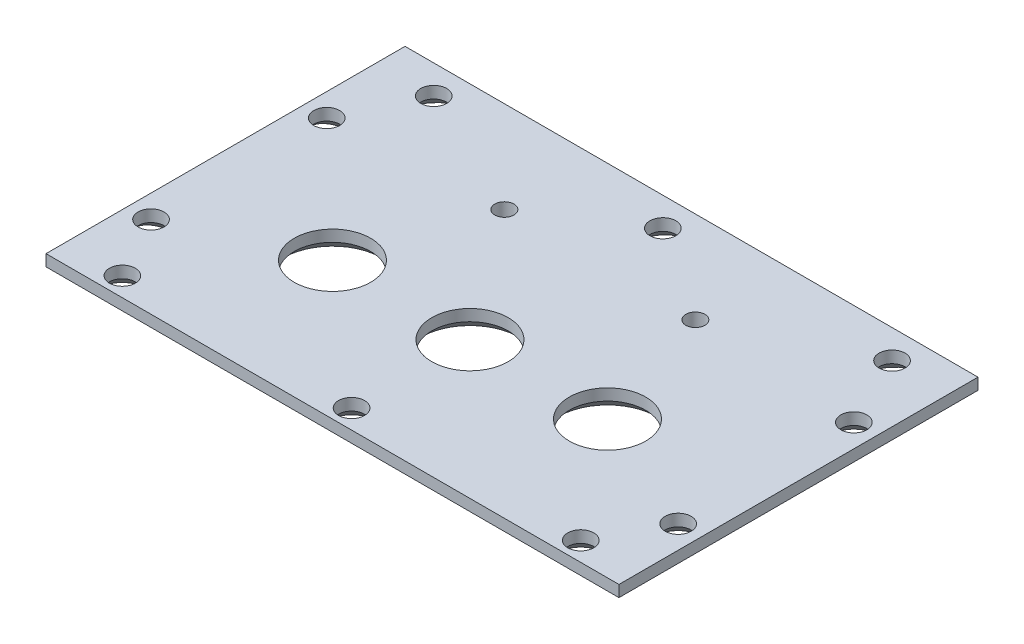
from build123d import *

# Parameters (mm, degrees)
SKETCH_1_W                 = 75
SKETCH_1_H                 = 47
SKETCH_1_R                 = 5
EXTRUDE_731_DEPTH          = 3
HOLE_WIZARD_M3_AT_2_COUNT  = 2
HOLE_WIZARD_M3_AT_2_PITCH  = 30
HOLE_WIZARD_M3_AT_3_COUNT  = 2
HOLE_WIZARD_M3_AT_3_PITCH  = 30
HOLE_WIZARD_M3_AT_4_COUNT  = 2
HOLE_WIZARD_M3_AT_4_PITCH  = 40.75
HOLE_WIZARD_M3_AT_5_COUNT  = 2
HOLE_WIZARD_M3_AT_5_PITCH  = 50.602000949
HOLE_WIZARD_M3_AT_6_COUNT  = 2
HOLE_WIZARD_M3_AT_6_PITCH  = 50.602000949
HOLE_WIZARD_M3_AT_7_COUNT  = 2
HOLE_WIZARD_M3_AT_7_PITCH  = 35.472700771
HOLE_WIZARD_M3_AT_8_COUNT  = 2
HOLE_WIZARD_M3_AT_8_PITCH  = 35.472700771
HOLE_WIZARD_M3_AT_9_COUNT  = 2
HOLE_WIZARD_M3_AT_9_PITCH  = 46.549033287
HOLE_WIZARD_M3_AT_10_COUNT = 2
HOLE_WIZARD_M3_AT_10_PITCH = 46.549033287
HOLE_WIZARD_M3_2_D         = 2.5
CHAMFER_1_SIZE             = 1.5


with BuildPart() as part:
    # Эскиз1 → Extrude 731 (new body)
    with BuildSketch(Plane(origin=(0, 0, 0), x_dir=(1, 0, 0), z_dir=(0, 1, 0))):
        with Locations((0, -23.5)):
            Rectangle(SKETCH_1_W, SKETCH_1_H)
        with Locations(Location((18, -29, 0), (0, 0, 270))):
            Circle(SKETCH_1_R, mode=Mode.SUBTRACT)
        with Locations(Location((-18, -29, 0), (0, 0, 270))):
            Circle(SKETCH_1_R, mode=Mode.SUBTRACT)
        with Locations(Location((0, -29, 0), (0, 0, 270))):
            Circle(SKETCH_1_R, mode=Mode.SUBTRACT)
    extrude(amount=EXTRUDE_731_DEPTH)

    # Эскиз3 → Hole Wizard M3 (revolve, cut)
    with BuildSketch(Plane(origin=(0, 0, 44.5), x_dir=(0, 0, -1), z_dir=(1, 0, 0))):
        Polygon((0, 0), (0, 3), (1.7, 3), (1.7, 1.45), (3.15, 0), align=None)
    hole_wizard_m3 = revolve(axis=Axis((0, -6.35, 44.5), (0, 1, 0)), mode=Mode.SUBTRACT)

    # Hole Wizard M3 at 2: Hole Wizard M3 ×2
    with Locations(*[(i * HOLE_WIZARD_M3_AT_2_PITCH, 0, 0) for i in range(1, HOLE_WIZARD_M3_AT_2_COUNT)]):
        add(hole_wizard_m3, mode=Mode.SUBTRACT)

    # Hole Wizard M3 at 3: Hole Wizard M3 ×2
    with Locations(*[(-i * HOLE_WIZARD_M3_AT_3_PITCH, 0, 0) for i in range(1, HOLE_WIZARD_M3_AT_3_COUNT)]):
        add(hole_wizard_m3, mode=Mode.SUBTRACT)

    # Hole Wizard M3 at 4: Hole Wizard M3 ×2
    with Locations(*[(0, 0, -i * HOLE_WIZARD_M3_AT_4_PITCH) for i in range(1, HOLE_WIZARD_M3_AT_4_COUNT)]):
        add(hole_wizard_m3, mode=Mode.SUBTRACT)

    # Hole Wizard M3 at 5: Hole Wizard M3 ×2
    with Locations(*[Vector(-0.5928619311020034, 0, -0.8053041230802209) * (i * HOLE_WIZARD_M3_AT_5_PITCH) for i in range(1, HOLE_WIZARD_M3_AT_5_COUNT)]):
        add(hole_wizard_m3, mode=Mode.SUBTRACT)

    # Hole Wizard M3 at 6: Hole Wizard M3 ×2
    with Locations(*[Vector(0.5928619311020034, 0, -0.8053041230802209) * (i * HOLE_WIZARD_M3_AT_6_PITCH) for i in range(1, HOLE_WIZARD_M3_AT_6_COUNT)]):
        add(hole_wizard_m3, mode=Mode.SUBTRACT)

    # Hole Wizard M3 at 7: Hole Wizard M3 ×2
    with Locations(*[Vector(-0.972578891654415, 0, -0.23257321322170757) * (i * HOLE_WIZARD_M3_AT_7_PITCH) for i in range(1, HOLE_WIZARD_M3_AT_7_COUNT)]):
        add(hole_wizard_m3, mode=Mode.SUBTRACT)

    # Hole Wizard M3 at 8: Hole Wizard M3 ×2
    with Locations(*[Vector(0.972578891654415, 0, -0.23257321322170757) * (i * HOLE_WIZARD_M3_AT_8_PITCH) for i in range(1, HOLE_WIZARD_M3_AT_8_COUNT)]):
        add(hole_wizard_m3, mode=Mode.SUBTRACT)

    # Hole Wizard M3 at 9: Hole Wizard M3 ×2
    with Locations(*[Vector(0.7411539523694183, 0, -0.6713351017838932) * (i * HOLE_WIZARD_M3_AT_9_PITCH) for i in range(1, HOLE_WIZARD_M3_AT_9_COUNT)]):
        add(hole_wizard_m3, mode=Mode.SUBTRACT)

    # Hole Wizard M3 at 10: Hole Wizard M3 ×2
    with Locations(*[Vector(-0.7411539523694182, 0, -0.6713351017838932) * (i * HOLE_WIZARD_M3_AT_10_PITCH) for i in range(1, HOLE_WIZARD_M3_AT_10_COUNT)]):
        add(hole_wizard_m3, mode=Mode.SUBTRACT)

    # Hole Wizard M3 2 (through all)
    with Locations(Plane(origin=(0, 0, 0), x_dir=(-1, 0, 0), z_dir=(0, -1, 0))):
        with Locations((12.5, -12), (-12.5, -12)):
            Hole(HOLE_WIZARD_M3_2_D / 2)

    # Фаска1
    # the kernel refuses this chamfer: 1.5 mm, written as the material it takes off along each edge
    with BuildSketch(Plane(origin=(31.941147692, 0, 47), x_dir=(0, -0.02749587661058636, -0.9996219169112968), z_dir=(-1, 0, 0)), Plane(origin=(1.941147692, 0, 47), x_dir=(0, -0.02749587661058636, -0.9996219169112968), z_dir=(-1, 0, 0))) as chamfer_1_piece_1:
        Polygon((CHAMFER_1_SIZE * 0.999621916911, -CHAMFER_1_SIZE * 0.0274958766106), (-CHAMFER_1_SIZE * 0.0274958766106, -CHAMFER_1_SIZE * 0.999621916911), (0, 0), align=None)
    extrude(amount=33.882295385, mode=Mode.SUBTRACT)
    with BuildSketch(Plane(origin=(0, 0, 29), x_dir=(0, 0, 1), z_dir=(-1, 0, 0))) as chamfer_1_piece_2:
        Polygon((5 + CHAMFER_1_SIZE, 0), (5, CHAMFER_1_SIZE), (5, 0), align=None)
    revolve(axis=Axis((0, 0, 29), (0, 1, 0)), mode=Mode.SUBTRACT)
    with BuildSketch(Plane(origin=(18, 0, 29), x_dir=(0, 0, 1), z_dir=(-1, 0, 0))) as chamfer_1_piece_3:
        Polygon((5 + CHAMFER_1_SIZE, 0), (5, CHAMFER_1_SIZE), (5, 0), align=None)
    revolve(axis=Axis((18, 0, 29), (0, 1, 0)), mode=Mode.SUBTRACT)
    with BuildSketch(Plane(origin=(-18, 0, 29), x_dir=(0, 0, 1), z_dir=(-1, 0, 0))) as chamfer_1_piece_4:
        Polygon((5 + CHAMFER_1_SIZE, 0), (5, CHAMFER_1_SIZE), (5, 0), align=None)
    revolve(axis=Axis((-18, 0, 29), (0, 1, 0)), mode=Mode.SUBTRACT)
    with BuildSketch(Plane(origin=(-37.5, 0, 39.147055846), x_dir=(-0.027495876610586778, 0.9996219169112968, 0), z_dir=(0, 0, -1)), Plane(origin=(37.5, 0, 10.352944154), x_dir=(0.027495876610586778, 0.9996219169112968, 0), z_dir=(0, 0, 1))) as chamfer_1_piece_5:
        Polygon((CHAMFER_1_SIZE * 0.999621916911, CHAMFER_1_SIZE * 0.0274958766106), (-CHAMFER_1_SIZE * 0.0274958766106, CHAMFER_1_SIZE * 0.999621916911), (0, 0), align=None)
    extrude(amount=28.794111693, mode=Mode.SUBTRACT)
    with BuildSketch(Plane(origin=(37.5, 0, -3.857524482), x_dir=(0.027495876610586778, 0.9996219169112968, 0), z_dir=(0, 0, 1)), Plane(origin=(-37.5, 0, 16.147055846), x_dir=(-0.027495876610586778, 0.9996219169112968, 0), z_dir=(0, 0, -1))) as chamfer_1_piece_6:
        Polygon((CHAMFER_1_SIZE * 0.999621916911, CHAMFER_1_SIZE * 0.0274958766106), (-CHAMFER_1_SIZE * 0.0274958766106, CHAMFER_1_SIZE * 0.999621916911), (0, 0), align=None)
    extrude(amount=20.004580328, mode=Mode.SUBTRACT)
    with BuildSketch(Plane(origin=(-28.058852308, 0, 47), x_dir=(0, -0.02749587661058636, -0.9996219169112968), z_dir=(-1, 0, 0)), Plane(origin=(41.357524482, 0, 47), x_dir=(0, -0.02749587661058636, -0.9996219169112968), z_dir=(-1, 0, 0))) as chamfer_1_piece_7:
        Polygon((CHAMFER_1_SIZE * 0.999621916911, -CHAMFER_1_SIZE * 0.0274958766106), (-CHAMFER_1_SIZE * 0.0274958766106, -CHAMFER_1_SIZE * 0.999621916911), (0, 0), align=None)
    extrude(amount=13.298672174, mode=Mode.SUBTRACT)
    with BuildSketch(Plane(origin=(-41.357524482, 0, 0), x_dir=(0, 0.9996219169112968, -0.027495876610586372), z_dir=(1, 0, 0))) as chamfer_1_piece_8:
        Polygon((CHAMFER_1_SIZE * 0.999621916911, CHAMFER_1_SIZE * 0.0274958766106), (-CHAMFER_1_SIZE * 0.0274958766106, CHAMFER_1_SIZE * 0.999621916911), (0, 0), align=None)
    extrude(amount=82.715048964, mode=Mode.SUBTRACT)
    with BuildSketch(Plane(origin=(37.5, 0, 33.352944154), x_dir=(0.027495876610586778, 0.9996219169112968, 0), z_dir=(0, 0, 1)), Plane(origin=(-37.5, 0, 50.857524482), x_dir=(-0.027495876610586778, 0.9996219169112968, 0), z_dir=(0, 0, -1))) as chamfer_1_piece_9:
        Polygon((CHAMFER_1_SIZE * 0.999621916911, CHAMFER_1_SIZE * 0.0274958766106), (-CHAMFER_1_SIZE * 0.0274958766106, CHAMFER_1_SIZE * 0.999621916911), (0, 0), align=None)
    extrude(amount=17.504580328, mode=Mode.SUBTRACT)


solid = part.part
